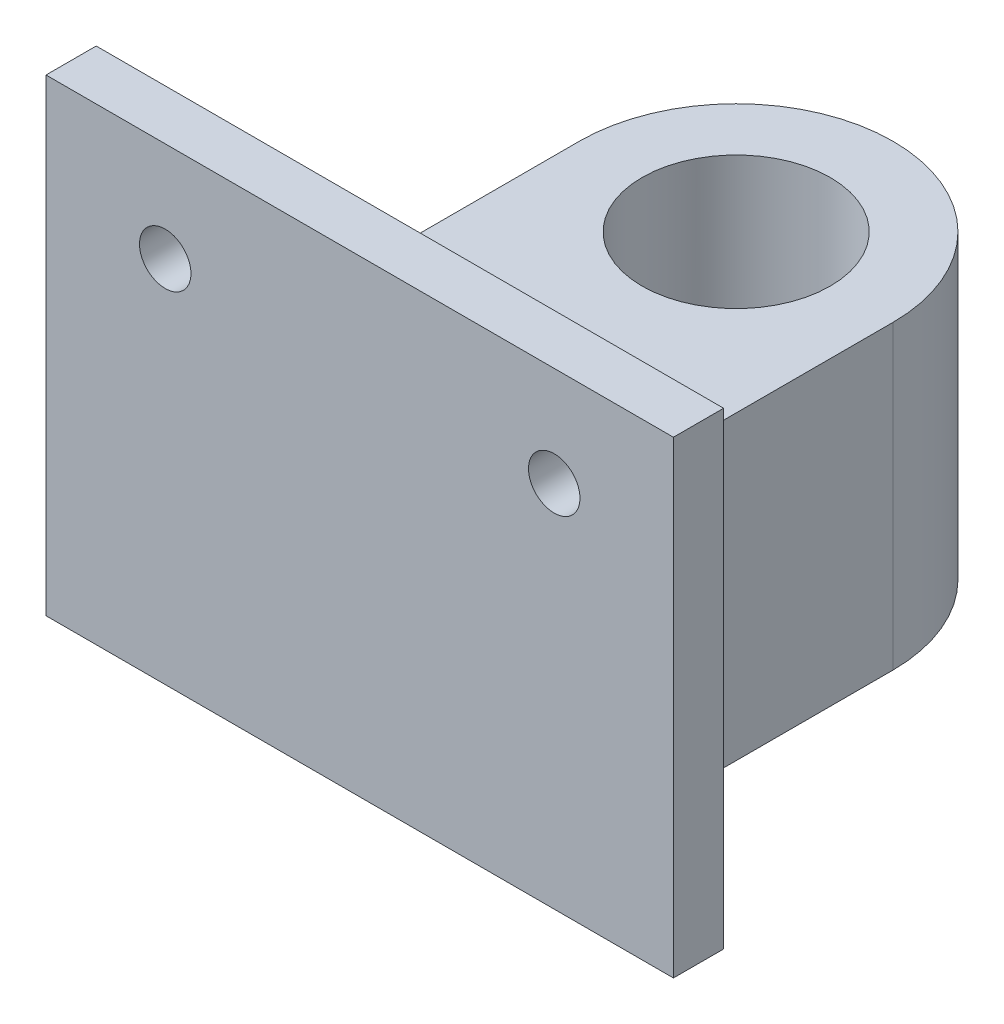
from build123d import *

# Parameters (mm, degrees)
PROFILE_SKETCH1_R                  = 7.5
PROFILE_BOSS_EXTRUDE2_DEPTH        = 37.32237
FASTENINGHOLESKETCH3_R             = 2.05
FASTENINGHOLECUT_EXTRUDE8_DEPTH    = 62.840191643
LM8UU_PLUGBOSS_EXTRUDE1_DEPTH      = 0.0001
LM8UU_PLUGBOSS_EXTRUDE1_DEPTH_BACK = 1
LM8UUPLUGSKETCH1_R                 = 7.5
LM8UUPLUGSKETCH1_R_2               = 4.5
CUT_EXTRUDE1_START                 = -13.32237
CUT_EXTRUDE1_DEPTH                 = 13.32237


with BuildPart() as part:
    # Profile-Sketch1 → Profile-Boss-Extrude2 (new body)
    with BuildSketch(Plane(origin=(0, 0, 0), x_dir=(1, 0, 0), z_dir=(0, 1, 0))):
        with BuildLine():
            Line((-25, -30), (25, -30))
            Line((25, -30), (25, -26))
            Line((25, -26), (22.5, -26))
            ThreePointArc((22.5, -26), (15.428932188, -23.071067812), (12.5, -16))
            Line((12.5, -16), (12.5, 0))
            ThreePointArc((12.5, 0), (0, 12.5), (-12.5, 0))
            Line((-12.5, 0), (-12.5, -16))
            ThreePointArc((-12.5, -16), (-15.428932188, -23.071067812), (-22.5, -26))
            Line((-22.5, -26), (-25, -26))
            Line((-25, -26), (-25, -30))
        make_face()
        Circle(PROFILE_SKETCH1_R, mode=Mode.SUBTRACT)
    extrude(amount=PROFILE_BOSS_EXTRUDE2_DEPTH)

    # FasteningHoleSketch3 → FasteningHoleCut-Extrude8 (cut, through all)
    with BuildSketch(Plane.XY.offset(30)):
        with Locations((-15.5, 29.38487)):
            Circle(FASTENINGHOLESKETCH3_R)
        with Locations((15.5, 29.38487)):
            Circle(FASTENINGHOLESKETCH3_R)
    extrude(amount=-FASTENINGHOLECUT_EXTRUDE8_DEPTH, mode=Mode.SUBTRACT)

    # LM8UUPlugSketch1 → LM8UU plugBoss-Extrude1 (add, two sides: drawn at the far end of the back side and taken through both)
    with BuildSketch(Plane.XZ.offset(-LM8UU_PLUGBOSS_EXTRUDE1_DEPTH_BACK)):
        Circle(LM8UUPLUGSKETCH1_R)
        Circle(LM8UUPLUGSKETCH1_R_2, mode=Mode.SUBTRACT)
    extrude(amount=LM8UU_PLUGBOSS_EXTRUDE1_DEPTH + LM8UU_PLUGBOSS_EXTRUDE1_DEPTH_BACK)

    # Sketch2 → Cut-Extrude1 (cut)
    with BuildSketch(Plane(origin=(0, 37.32237, 0), x_dir=(1, 0, 0), z_dir=(0, 1, 0)).offset(CUT_EXTRUDE1_START)):
        with BuildLine():
            Line((-12.5, 0), (-12.5, -16))
            ThreePointArc((-12.5, -16), (-15.428932188, -23.071067812), (-22.5, -26))
            Line((-22.5, -26), (22.5, -26))
            ThreePointArc((22.5, -26), (15.428932188, -23.071067812), (12.5, -16))
            Line((12.5, -16), (12.5, 0))
            ThreePointArc((12.5, 0), (0, 12.5), (-12.5, 0))
        make_face()
    extrude(amount=CUT_EXTRUDE1_DEPTH, mode=Mode.SUBTRACT)


solid = part.part
